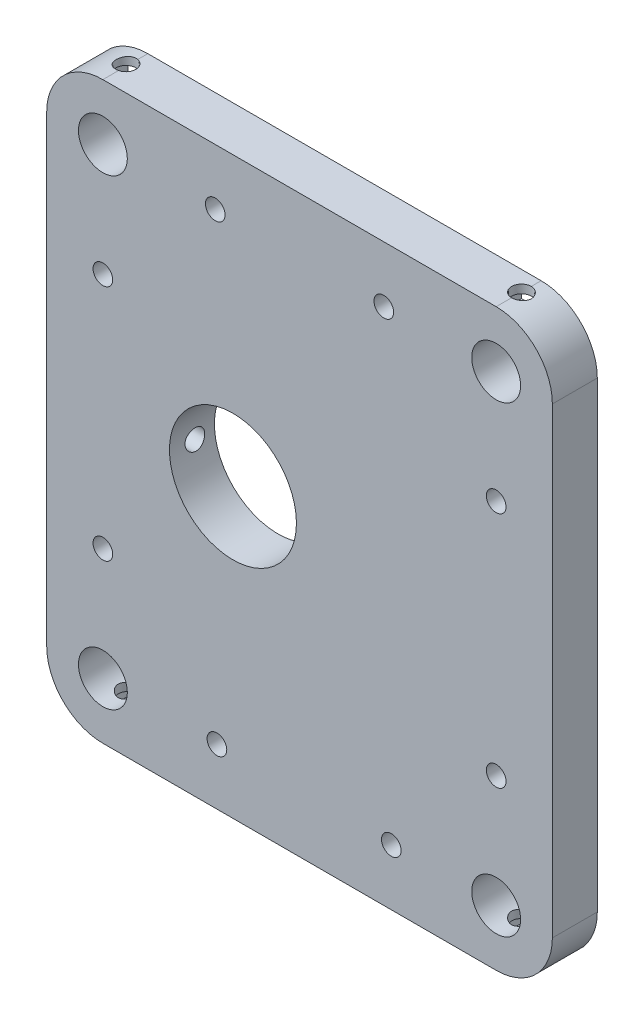
from build123d import *
from OCP.BRepAlgoAPI import BRepAlgoAPI_Cut
from OCP.TopTools import TopTools_ListOfShape

# Parameters (mm, degrees)
CROQUIS1_R              = 1.75
CROQUIS1_R_2            = 11.3
CROQUIS1_R_3            = 4.35
SALIENTE_EXTRUIR1_DEPTH = 8
CROQUIS3_W              = 7
CROQUIS3_H              = 3
CROQUIS3_W_2            = 3.5
CROQUIS3_H_2            = 8
CORTAR_EXTRUIR2_DEPTH   = 7
CORTAR_EXTRUIR4_START   = 43.694121903
CORTAR_EXTRUIR4_DEPTH   = 11.305878097
CORTAR_EXTRUIR5_START   = 43.694121903
CORTAR_EXTRUIR5_DEPTH   = 11.305878097
CORTAR_EXTRUIR6_START   = -35
CROQUIS6_R              = 1.75
CORTAR_EXTRUIR6_DEPTH   = 23
CORTAR_EXTRUIR7_START   = 0.389048
CROQUIS7_R              = 1.75
CORTAR_EXTRUIR7_DEPTH   = 22.090368


with BuildPart() as part:
    # Croquis1 → Saliente-Extruir1 (new body)
    with BuildSketch(Plane.XY):
        with BuildLine():
            Line((90.389048187, -28.605878097), (90.389048187, -38.605878097))
            ThreePointArc((90.389048187, -38.605878097), (87.460115999, -45.676945909), (80.389048187, -48.605878097))
            Line((80.389048187, -48.605878097), (10.389048187, -48.605878097))
            ThreePointArc((10.389048187, -48.605878097), (3.317980376, -45.676945909), (0.389048187, -38.605878097))
            Line((0.389048187, -38.605878097), (0.389048187, 43.694121903))
            ThreePointArc((0.389048187, 43.694121903), (3.317980376, 50.765189715), (10.389048187, 53.694121903))
            Line((10.389048187, 53.694121903), (80.389048187, 53.694121903))
            ThreePointArc((80.389048187, 53.694121903), (87.460115999, 50.765189715), (90.389048187, 43.694121903))
            Line((90.389048187, 43.694121903), (90.389048187, 33.694121903))
            Line((90.389048187, 33.694121903), (90.389048187, -28.605878097))
        make_face()
        with Locations((10.389048187, 23.694121903)):
            Circle(CROQUIS1_R, mode=Mode.SUBTRACT)
        with Locations((10.389048187, -18.605878097)):
            Circle(CROQUIS1_R, mode=Mode.SUBTRACT)
        with Locations((30.688896231, -38.605878097)):
            Circle(CROQUIS1_R, mode=Mode.SUBTRACT)
        with Locations((61.724530274, -38.605878097)):
            Circle(CROQUIS1_R, mode=Mode.SUBTRACT)
        with Locations((80.389048187, 23.694121903)):
            Circle(CROQUIS1_R, mode=Mode.SUBTRACT)
        with Locations((33.539048187, 2.544121903)):
            Circle(CROQUIS1_R_2, mode=Mode.SUBTRACT)
        with Locations((80.389048187, -18.605878097)):
            Circle(CROQUIS1_R, mode=Mode.SUBTRACT)
        with Locations((60.389048187, 43.694121903)):
            Circle(CROQUIS1_R, mode=Mode.SUBTRACT)
        with Locations((10.389048187, 43.694121903)):
            Circle(CROQUIS1_R_3, mode=Mode.SUBTRACT)
        with Locations((80.389048187, 43.694121903)):
            Circle(CROQUIS1_R_3, mode=Mode.SUBTRACT)
        with Locations((10.389048187, -38.605878097)):
            Circle(CROQUIS1_R_3, mode=Mode.SUBTRACT)
        with Locations((80.389048187, -38.605878097)):
            Circle(CROQUIS1_R_3, mode=Mode.SUBTRACT)
        with Locations((30.389048187, 43.694121903)):
            Circle(CROQUIS1_R, mode=Mode.SUBTRACT)
    extrude(amount=SALIENTE_EXTRUIR1_DEPTH)

    # Croquis3 → Cortar-Extruir2 (cut)
    with BuildSketch(Plane.XY):
        with Locations((10.389048187, 50.694121903)):
            Rectangle(CROQUIS3_W, CROQUIS3_H)
        with Locations((80.389048187, 50.694121903)):
            Rectangle(CROQUIS3_W, CROQUIS3_H)
        with Locations((10.389048187, -45.605878097)):
            Rectangle(CROQUIS3_W, CROQUIS3_H)
        with Locations((80.389048187, -45.605878097)):
            Rectangle(CROQUIS3_W, CROQUIS3_H)
        with Locations((13.539048187, 2.544121903)):
            Rectangle(CROQUIS3_W_2, CROQUIS3_H_2)
    extrude(amount=CORTAR_EXTRUIR2_DEPTH, mode=Mode.SUBTRACT)

    # Cortar-Extruir4: read off the stored shape, not the designer's step
    # Cortar-Extruir4 outline → Cortar-Extruir4 (cut)
    with BuildSketch(Plane(origin=(0, 0, 0), x_dir=(1, 0, 0), z_dir=(0, 1, 0)).offset(CORTAR_EXTRUIR4_START)):
        with BuildLine():
            add(Edge.make_bspline(
                [(10, -1.75), (10.466963096, -1.75), (10.925817058, -1.945958796), (11.568319308, -2.598581209), (11.755931548, -3.058061383), (11.743768961, -3.987724464), (11.543658031, -4.4434418), (10.882294622, -5.079404554), (10.413932458, -5.261541677), (9.493668374, -5.237238453), (9.052176088, -5.037857128), (8.429631099, -4.392925658), (8.244353906, -3.940515747), (8.255919777, -3.015715473), (8.452338784, -2.567615644), (9.093334173, -1.937133113), (9.533036904, -1.75), (10, -1.75)],
                knots=[0, 0, 0, 0, 0.125, 0.125, 0.25, 0.25, 0.375, 0.375, 0.5, 0.5, 0.625, 0.625, 0.75, 0.75, 0.875, 0.875, 1, 1, 1, 1], degree=3))
        make_face()
    extrude(amount=CORTAR_EXTRUIR4_DEPTH, mode=Mode.SUBTRACT)

    # Cortar-Extruir5: read off the stored shape, not the designer's step
    # Cortar-Extruir5 outline → Cortar-Extruir5 (cut)
    with BuildSketch(Plane(origin=(0, 0, 0), x_dir=(1, 0, 0), z_dir=(0, 1, 0)).offset(CORTAR_EXTRUIR5_START)):
        with BuildLine():
            add(Edge.make_bspline(
                [(80.389048187, -1.75), (80.856745378, -1.75), (81.307898112, -1.943731362), (81.946021688, -2.582344959), (82.138515507, -3.035924965), (82.139578552, -3.960048893), (81.94704045, -4.416608445), (81.30698381, -5.057210688), (80.85156655, -5.249506943), (79.930268473, -5.25049106), (79.474562929, -5.060357282), (78.828779255, -4.41463599), (78.639361405, -3.96268404), (78.638735774, -3.039688355), (78.829700425, -2.584942834), (79.471719554, -1.941987407), (79.921350997, -1.75), (80.389048187, -1.75)],
                knots=[0, 0, 0, 0, 0.125, 0.125, 0.25, 0.25, 0.375, 0.375, 0.5, 0.5, 0.625, 0.625, 0.75, 0.75, 0.875, 0.875, 1, 1, 1, 1], degree=3))
        make_face()
    extrude(amount=CORTAR_EXTRUIR5_DEPTH, mode=Mode.SUBTRACT)

    # Croquis6 → Cortar-Extruir6 (cut)
    with BuildSketch(Plane(origin=(0, 0, 0), x_dir=(1, 0, 0), z_dir=(0, 1, 0)).offset(CORTAR_EXTRUIR6_START)):
        with Locations(Location((10.389048187, -3.5, 0), (0, 0, 270))):
            Circle(CROQUIS6_R)
        with Locations(Location((80.389048187, -3.5, 0), (0, 0, 270))):
            Circle(CROQUIS6_R)
    extrude(amount=-CORTAR_EXTRUIR6_DEPTH, mode=Mode.SUBTRACT)


with BuildPart() as cortar_extruir7_tool:
    # Croquis7 → Cortar-Extruir7 (new body)
    with BuildSketch(Plane(origin=(0, 0, 0), x_dir=(0, 0, -1), z_dir=(1, 0, 0)).offset(CORTAR_EXTRUIR7_START)):
        with Locations(Location((-3.5, 1.975806023, 0), (0, 0, 180))):
            Circle(CROQUIS7_R)
    extrude(amount=CORTAR_EXTRUIR7_DEPTH)


with BuildPart() as part_1:
    add(part.part)

    # Cortar-Extruir7: cut by cortar_extruir7_tool, with a tolerance
    cortar_extruir7_stock = TopTools_ListOfShape()
    cortar_extruir7_stock.Append(part_1.part.wrapped)
    cortar_extruir7_tools = TopTools_ListOfShape()
    cortar_extruir7_tools.Append(cortar_extruir7_tool.part.wrapped)
    cortar_extruir7_cut = BRepAlgoAPI_Cut()
    cortar_extruir7_cut.SetArguments(cortar_extruir7_stock)
    cortar_extruir7_cut.SetTools(cortar_extruir7_tools)
    cortar_extruir7_cut.SetFuzzyValue(0.00001)
    cortar_extruir7_cut.Build()
    add(Compound.cast(cortar_extruir7_cut.Shape()).solids(), mode=Mode.REPLACE)


solid = part_1.part
